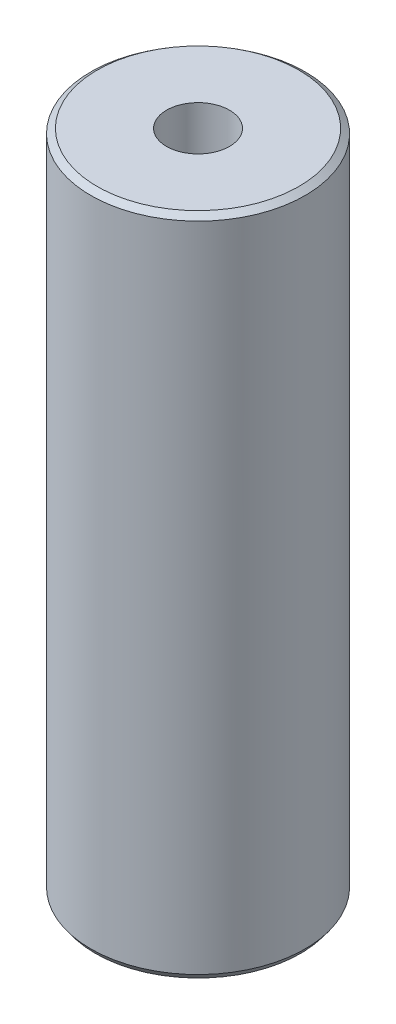
from build123d import *
from OCP.BRepFilletAPI import BRepFilletAPI_MakeChamfer

# Parameters (mm, degrees)
SKETCH1_R           = 55
BOSS_EXTRUDE1_DEPTH = 340.449711949
SKETCH2_R           = 16.153464706
CUT_EXTRUDE1_DEPTH  = 350.222001549
CHAMFER1_SIZE       = 2.38201253
CHAMFER1_SIZE2      = 3.238850903


with BuildPart() as part:
    # Sketch1 → Boss-Extrude1 (new body)
    with BuildSketch(Plane(origin=(0, 0, 0), x_dir=(1, 0, 0), z_dir=(0, 1, 0))):
        Circle(SKETCH1_R)
    extrude(amount=BOSS_EXTRUDE1_DEPTH)

    # Sketch2 → Cut-Extrude1 (cut, through all)
    with BuildSketch(Plane(origin=(0, 0, 0), x_dir=(1, 0, 0), z_dir=(0, 1, 0))):
        Circle(SKETCH2_R)
    extrude(amount=CUT_EXTRUDE1_DEPTH, mode=Mode.SUBTRACT)

    # Chamfer1: one chamfer whose edges measure the first distance from different faces: ONE call of the kernel's chamfer builder (chamfer() names one face for all edges)
    chamfer1_edges_1 = [part.edges().sort_by_distance(p)[0] for p in [
        (-55, 340.449711949, 0),
    ]]
    chamfer1_side_1 = [part.faces().sort_by_distance(p)[0] for p in [
        (-55, 170.224855974, 0),
    ]]
    chamfer1_edges_2 = [part.edges().sort_by_distance(p)[0] for p in [
        (-55, 0, 0),
    ]]
    chamfer1_side_2 = [part.faces().sort_by_distance(p)[0] for p in [
        (-53.444365081, 0, 0),
    ]]
    chamfer1 = BRepFilletAPI_MakeChamfer(part.part.solid().wrapped)
    for e in chamfer1_edges_1:
        chamfer1.Add(CHAMFER1_SIZE, CHAMFER1_SIZE2, e.wrapped, chamfer1_side_1[0].wrapped)  # the first distance lies on this face
    for e in chamfer1_edges_2:
        chamfer1.Add(CHAMFER1_SIZE, CHAMFER1_SIZE2, e.wrapped, chamfer1_side_2[0].wrapped)  # the first distance lies on this face
    add(Compound.cast(chamfer1.Shape()), mode=Mode.REPLACE)


solid = part.part
